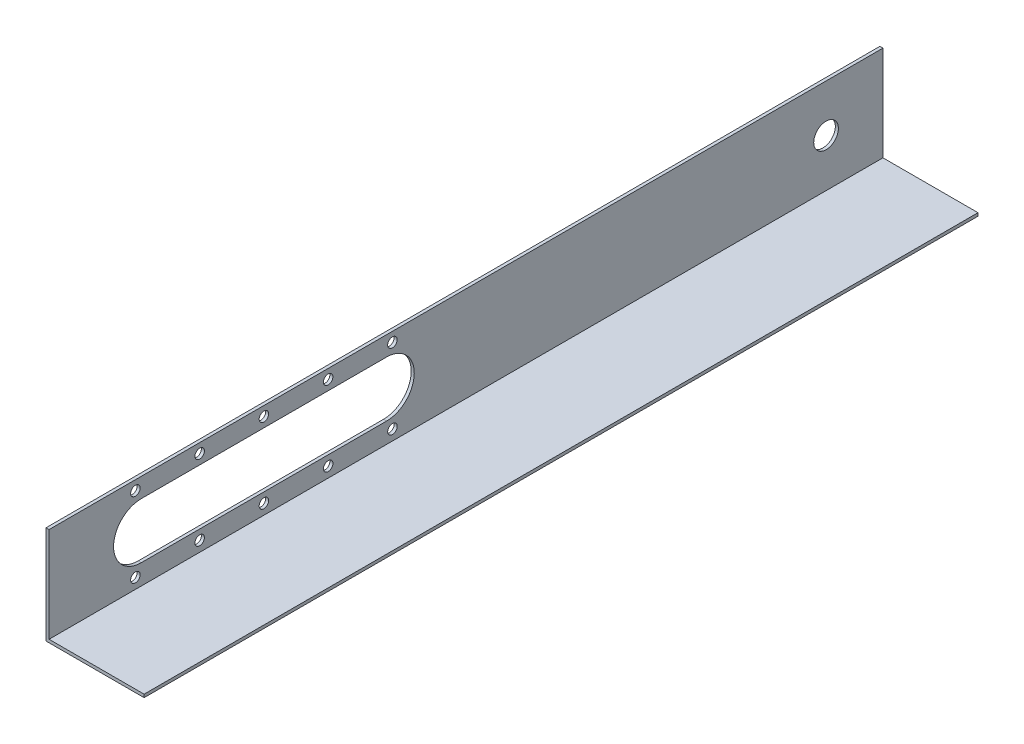
from build123d import *

# Parameters (mm, degrees)
BOSS_EXTRUDE2_DEPTH          = 431.8
CUT_EXTRUDE3_DEPTH           = 127
SKETCH7_R                    = 6.3881
CUT_EXTRUDE4_DEPTH           = 438.372816156
F_10_0_1935_DIAMETER_HOLE3_D = 4.9149


with BuildPart() as part:
    # Sketch3 → Boss-Extrude2 (new body)
    with BuildSketch(Plane.XY):
        Polygon((0, 0), (0, 49.2125), (-1.5875, 49.2125), (-1.5875, -1.5875), (49.2125, -1.5875), (49.2125, 0), align=None)
    extrude(amount=BOSS_EXTRUDE2_DEPTH)

    # Sketch6 → Cut-Extrude3 (cut)
    with BuildSketch(Plane(origin=(0, 0, 0), x_dir=(0, 0, -1), z_dir=(1, 0, 0))):
        with BuildLine():
            Line((-384.048, 39.1795), (-257.048, 39.1795))
            ThreePointArc((-257.048, 39.1795), (-242.697, 24.8285), (-257.048, 10.4775))
            Line((-257.048, 10.4775), (-384.048, 10.4775))
            ThreePointArc((-384.048, 10.4775), (-398.399, 24.8285), (-384.048, 39.1795))
        make_face()
    extrude(amount=-CUT_EXTRUDE3_DEPTH, mode=Mode.SUBTRACT)

    # Sketch7 → Cut-Extrude4 (cut, through all)
    with BuildSketch(Plane(origin=(0, 0, 0), x_dir=(0, 0, -1), z_dir=(1, 0, 0))):
        with Locations((-29.464, 24.773594829)):
            Circle(SKETCH7_R)
    extrude(amount=-CUT_EXTRUDE4_DEPTH, mode=Mode.SUBTRACT)

    # #10 (0.1935) Diameter Hole3 (through all)
    with Locations(Plane(origin=(0, 0, 0), x_dir=(0, 0, -1), z_dir=(1, 0, 0))):
        with Locations((-254, 44.2595), (-287.274, 44.2595), (-320.548, 44.2595), (-254, 5.3975), (-287.274, 5.3975), (-320.548, 5.3975), (-353.822, 44.2595), (-387.096, 44.2595), (-387.096, 5.3975), (-353.822, 5.3975)):
            Hole(F_10_0_1935_DIAMETER_HOLE3_D / 2)


solid = part.part
